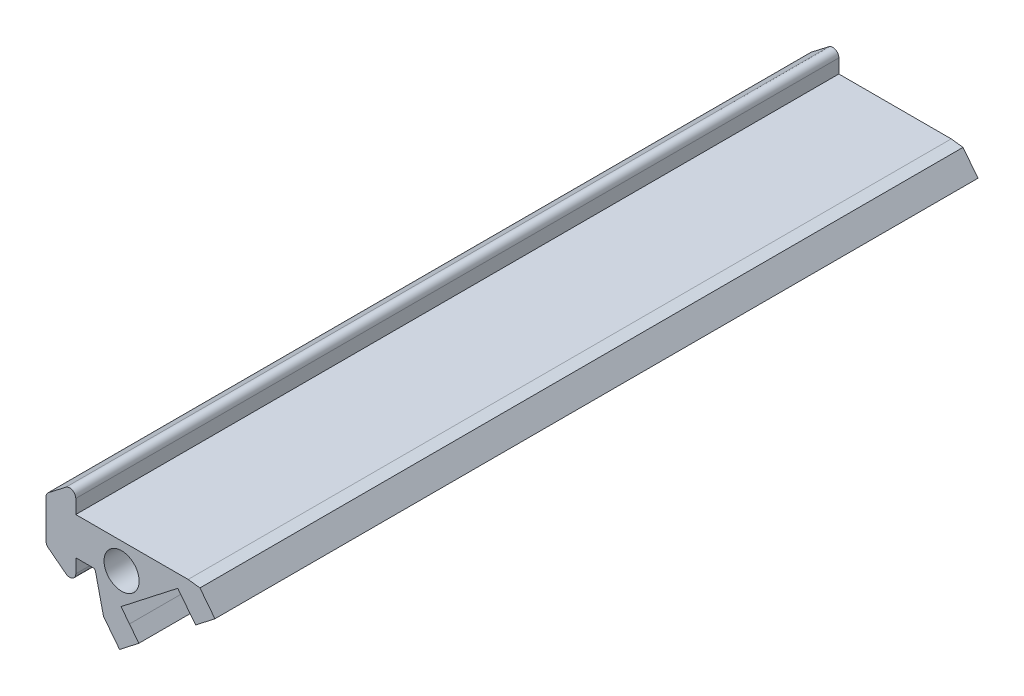
from build123d import *

# Parameters (mm, degrees)
BOSS_EXTRUDE1_DEPTH = 99.95
BOSS_EXTRUDE2_DEPTH = 99.95
SKETCH3_R           = 2.3
CUT_EXTRUDE1_DEPTH  = 203
SKETCH4_W           = 3.5
SKETCH4_H           = 4
CUT_EXTRUDE2_DEPTH  = 3
LPATTERN1_COUNT     = 10
LPATTERN1_PITCH     = 20
THICKEN1_T1         = 2
THICKEN2_T1         = 2
BOSS_EXTRUDE3_DEPTH = 99.95
CHAMFER1_SIZE       = 4.717915225
CHAMFER1_SIZE_2     = 2.2
CHAMFER2_SIZE       = 2.2


with BuildPart() as part:
    # Sketch1 → Boss-Extrude1 (new body)
    with BuildSketch(Plane.XY):
        with BuildLine():
            Line((0, 0.393921198), (0, 5.406078802))
            ThreePointArc((0, 5.406078802), (0.08229014, 5.759480212), (0.312231391, 6.040177993))
            Line((0.312231391, 6.040177993), (2.612231391, 7.809408763))
            ThreePointArc((2.612231391, 7.809408763), (3.45340141, 7.893019432), (3.9, 7.175309571))
            Line((3.9, 7.175309571), (3.9, 5.35))
            Line((3.9, 5.35), (6.3, 5.35))
            Line((6.3, 5.35), (6.3, 0.45))
            Line((6.3, 0.45), (3.9, 0.45))
            Line((3.9, 0.45), (3.9, -1.375309571))
            ThreePointArc((3.9, -1.375309571), (3.45340141, -2.093019432), (2.612231391, -2.009408763))
            Line((2.612231391, -2.009408763), (0.312231391, -0.240177993))
            ThreePointArc((0.312231391, -0.240177993), (0.08229014, 0.040519788), (0, 0.393921198))
        make_face()
    extrude(amount=BOSS_EXTRUDE1_DEPTH)

    # Sketch2 → Boss-Extrude2 (add)
    with BuildSketch(Plane.XY.offset(99.95)):
        Polygon((17.472453889, 5.35), (6.3, 5.35), (6.3, 0.45), (9.987087866, -4.283432483), (10.933774362, -3.54601491), (9.831668963, -2.122862181), (17.26318939, 3.66589025), (18.369311325, 2.245866185), (19.315997822, 2.983283759), align=None)
    extrude(amount=-BOSS_EXTRUDE2_DEPTH)

    # Sketch3 → Cut-Extrude1 (cut)
    with BuildSketch(Plane.XY.offset(99.95)):
        with Locations((9.9, 1.95)):
            Circle(SKETCH3_R)
    extrude(amount=-CUT_EXTRUDE1_DEPTH, mode=Mode.SUBTRACT)

    # Sketch4 → Cut-Extrude2 (cut)
    with BuildSketch(Plane(origin=(6.0943119, -5.034061174, 0), x_dir=(0, 0, -1), z_dir=(0.6145146443247225, -0.7889054137920846, 0))):
        with Locations((-88.2, 8.814603366)):
            Rectangle(SKETCH4_W, SKETCH4_H)
    cut_extrude2 = extrude(amount=-CUT_EXTRUDE2_DEPTH, mode=Mode.SUBTRACT)

    # LPattern1: Cut-Extrude2 ×10
    with Locations(*[(0, 0, -i * LPATTERN1_PITCH) for i in range(1, LPATTERN1_COUNT)]):
        add(cut_extrude2, mode=Mode.SUBTRACT)

    # Surface-Offset1: a surface, a copy of 1 face of the part
    surface_offset1_1 = part.part.faces().sort_by_distance((10.460431114, -3.914723696, 49.975))[0]
    add(Solid.thicken(surface_offset1_1, THICKEN1_T1))

    # Surface-Offset2: a surface, a copy of 1 face of the part
    surface_offset2_2 = part.part.faces().sort_by_distance((18.842654573, 2.614574972, 49.975))[0]
    add(Solid.thicken(surface_offset2_2, THICKEN2_T1))

    # Sketch5 → Boss-Extrude3 (add)
    with BuildSketch(Plane.XY.offset(99.95)):
        Polygon((11.216117155, -5.86124331), (9.638306327, -7.090272599), (7.794762394, -4.723556358), (9.372573222, -3.494527069), align=None)
        Polygon((22.126854473, 2.637630884), (20.28331054, 5.004347125), (17.754796681, 3.034771599), (19.598340614, 0.668055358), align=None)
    extrude(amount=-BOSS_EXTRUDE3_DEPTH)

    # Chamfer1
    # the kernel refuses this chamfer: 4.717915225, 2.2 mm, written as the material it adds along each edge
    with BuildSketch(Plane(origin=(9.372573222, -3.494527069, 99.95), x_dir=(-0.6015649261356993, 0.7988239102852083, 0), z_dir=(0, 0, -1))) as chamfer1_piece_1_section:
        Polygon((CHAMFER1_SIZE * 0.999866964139, -CHAMFER1_SIZE * 0.0163111641315), (-CHAMFER1_SIZE_2 * 0.0163111641311, -CHAMFER1_SIZE_2 * 0.999866964113), (0, 0), align=None)
    chamfer1_piece_1 = extrude(amount=99.95, mode=Mode.PRIVATE)
    chamfer1_piece_1 = split(chamfer1_piece_1, bisect_by=Plane(origin=(6.797025318, -3.442675278, 49.975), z_dir=(0.7889054137920843, 0.6145146443247225, 0)), keep=Keep.TOP, mode=Mode.PRIVATE)
    add(chamfer1_piece_1)

    # Chamfer2
    # the kernel refuses this chamfer: 2.2 mm, written as the material it adds along each edge
    with BuildSketch(Plane(origin=(18.701483177, 3.772189172, 0), x_dir=(-0.6359739526449933, 0.7717105231607922, 0), z_dir=(0, 0, 1))) as chamfer2_piece_1_section:
        Polygon((CHAMFER2_SIZE * 0.999621916911, -CHAMFER2_SIZE * 0.0274958766106), (-CHAMFER2_SIZE * 0.0274958766106, -CHAMFER2_SIZE * 0.999621916911), (0, 0), align=None)
    chamfer2_piece_1 = extrude(amount=99.95, mode=Mode.PRIVATE)
    chamfer2_piece_1 = split(chamfer2_piece_1, bisect_by=Plane(origin=(18.850985857, 5.35, 49.975), z_dir=(0, -1, 0)), keep=Keep.TOP, mode=Mode.PRIVATE)
    chamfer2_piece_1 = split(chamfer2_piece_1, bisect_by=Plane(origin=(19.861540809, 5.545809281, 49.975), z_dir=(-0.7889054137920902, -0.614514644324715, 0)), keep=Keep.TOP, mode=Mode.PRIVATE)
    add(chamfer2_piece_1)


solid = part.part
